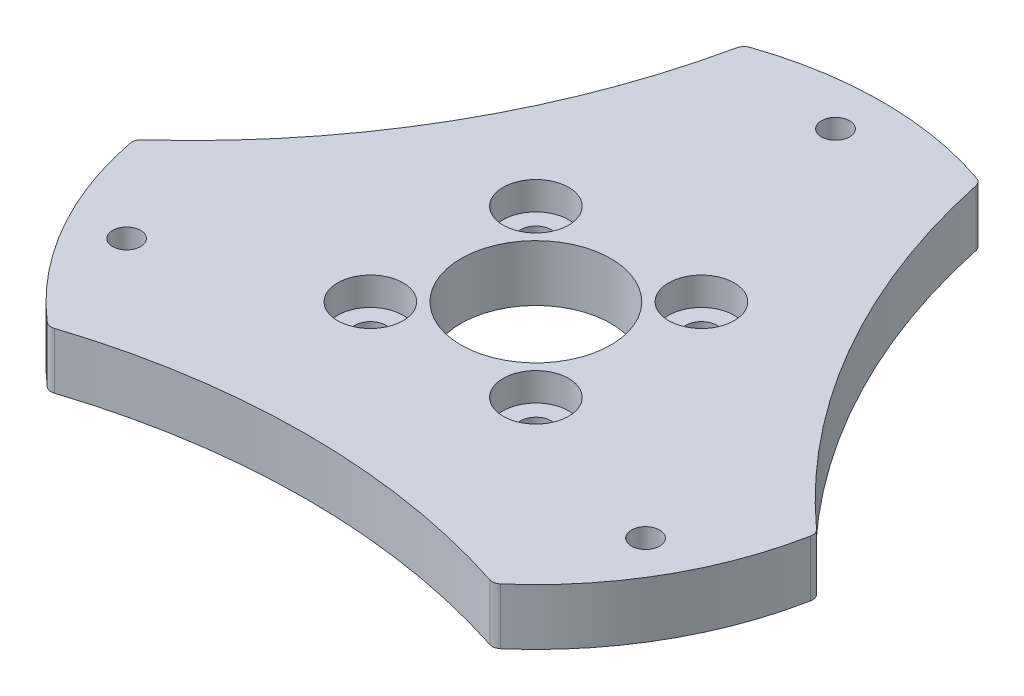
from build123d import *

# Parameters (mm, degrees)
SKETCH1_R           = 37
BOSS_EXTRUDE1_DEPTH = 6
SKETCH3_R           = 75.500139874
CUT_EXTRUDE1_DEPTH  = 53.668776329
SKETCH5_R           = 1.5
CUT_EXTRUDE2_DEPTH  = 53.668776329
CIRPATTERN1_COUNT   = 3
SKETCH6_R           = 1.65
CUT_EXTRUDE3_DEPTH  = 53.2754206
SKETCH7_R           = 8
CUT_EXTRUDE4_DEPTH  = 53.2754206
FILLET1_R           = 1
SKETCH8_R           = 3.5
CUT_EXTRUDE5_DEPTH  = 3


with BuildPart() as part:
    # Sketch1 → Boss-Extrude1 (new body)
    with BuildSketch(Plane(origin=(0, 0, 0), x_dir=(1, 0, 0), z_dir=(0, 1, 0))):
        Circle(SKETCH1_R)
    extrude(amount=BOSS_EXTRUDE1_DEPTH)

    # Sketch3 → Cut-Extrude1 (cut, through all)
    with BuildSketch(Plane(origin=(0, 6, 0), x_dir=(1, 0, 0), z_dir=(0, 1, 0))):
        with Locations((86.602540378, 50)):
            Circle(SKETCH3_R)
    cut_extrude1 = extrude(amount=-CUT_EXTRUDE1_DEPTH, mode=Mode.SUBTRACT)

    # Sketch5 → Cut-Extrude2 (cut, through all)
    with BuildSketch(Plane(origin=(0, 6, 0), x_dir=(1, 0, 0), z_dir=(0, 1, 0))):
        with Locations((0, 32)):
            Circle(SKETCH5_R)
    cut_extrude2 = extrude(amount=-CUT_EXTRUDE2_DEPTH, mode=Mode.SUBTRACT)

    # CirPattern1: Cut-Extrude1, Cut-Extrude2 ×3 about axis
    cirpattern1_axis = Axis((0, 6, 0), (0, -1, 0))
    add([cut_extrude1.rotate(cirpattern1_axis, i * 360 / CIRPATTERN1_COUNT) for i in range(1, CIRPATTERN1_COUNT)], mode=Mode.SUBTRACT)
    add([cut_extrude2.rotate(cirpattern1_axis, i * 360 / CIRPATTERN1_COUNT) for i in range(1, CIRPATTERN1_COUNT)], mode=Mode.SUBTRACT)

    # Sketch6 → Cut-Extrude3 (cut, through all)
    with BuildSketch(Plane(origin=(0, 6, 0), x_dir=(1, 0, 0), z_dir=(0, 1, 0))):
        with Locations((8.838834765, 8.838834765)):
            Circle(SKETCH6_R)
        with Locations((-8.838834765, 8.838834765)):
            Circle(SKETCH6_R)
        with Locations((-8.838834765, -8.838834765)):
            Circle(SKETCH6_R)
        with Locations((8.838834765, -8.838834765)):
            Circle(SKETCH6_R)
    extrude(amount=-CUT_EXTRUDE3_DEPTH, mode=Mode.SUBTRACT)

    # Sketch7 → Cut-Extrude4 (cut, through all)
    with BuildSketch(Plane(origin=(0, 6, 0), x_dir=(1, 0, 0), z_dir=(0, 1, 0))):
        Circle(SKETCH7_R)
    extrude(amount=-CUT_EXTRUDE4_DEPTH, mode=Mode.SUBTRACT)

    # Fillet1
    fillet1_edges = [part.edges().sort_by_distance(p)[0] for p in [
        (-36.437886861, 3, 6.424982574),
        (-12.654745303, 3, -34.768626969),
        (23.783141558, 3, 28.343644395),
        (-23.783141558, 3, 28.343644395),
        (36.437886861, 3, 6.424982574),
        (12.654745303, 3, -34.768626969),
    ]]
    fillet(fillet1_edges, radius=FILLET1_R)

    # Sketch8 → Cut-Extrude5 (cut)
    with BuildSketch(Plane.XZ.offset(-6)):
        with Locations((8.838834765, 8.838834765)):
            Circle(SKETCH8_R)
        with Locations((8.838834765, -8.838834765)):
            Circle(SKETCH8_R)
        with Locations((-8.838834765, 8.838834765)):
            Circle(SKETCH8_R)
        with Locations((-8.838834765, -8.838834765)):
            Circle(SKETCH8_R)
    extrude(amount=CUT_EXTRUDE5_DEPTH, mode=Mode.SUBTRACT)


solid = part.part
